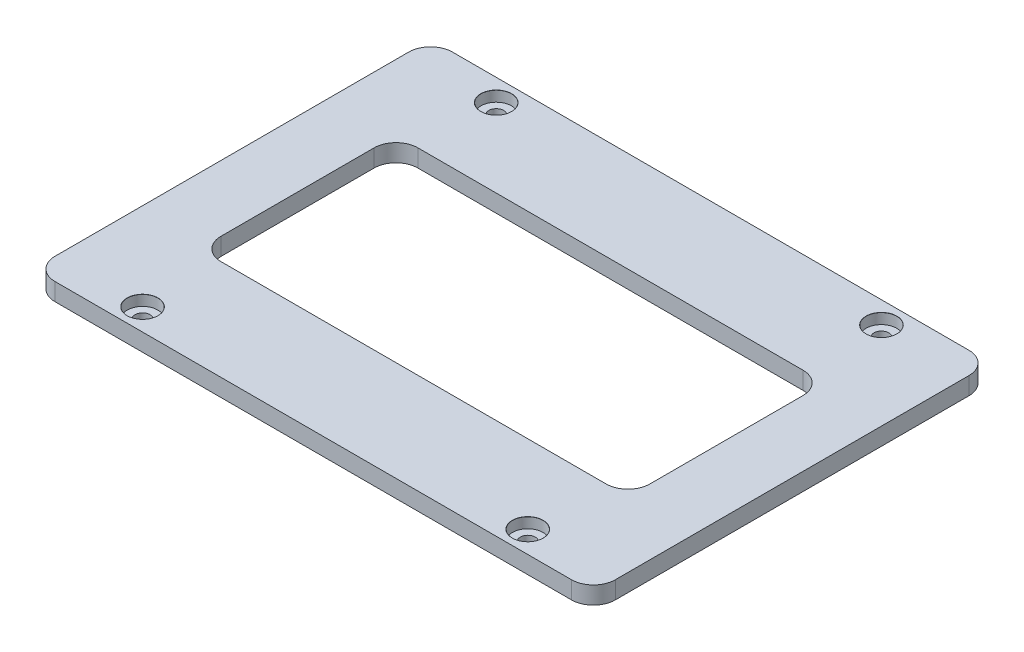
from build123d import *

# Parameters (mm, degrees)
SKETCH1_W                                     = 128
SKETCH1_H                                     = 90.8
BOSS_EXTRUDE1_DEPTH                           = 4
SKETCH2_W                                     = 98
SKETCH2_H                                     = 45
CUT_EXTRUDE1_DEPTH                            = 4
CBORE_FOR_M3_PAN_HEAD_MACHINE_SCREW1_AT_COUNT = 2
CBORE_FOR_M3_PAN_HEAD_MACHINE_SCREW1_AT_PITCH = 88
CBORE_FOR_M3_PAN_HEAD_MACHINE_SCREW1_2_COUNT  = 2
CBORE_FOR_M3_PAN_HEAD_MACHINE_SCREW1_2_PITCH  = 119.468154753
CBORE_FOR_M3_PAN_HEAD_MACHINE_SCREW1_3_COUNT  = 2
CBORE_FOR_M3_PAN_HEAD_MACHINE_SCREW1_3_PITCH  = 80.8
FILLET1_R                                     = 5


with BuildPart() as part:
    # Sketch1 → Boss-Extrude1 (new body)
    with BuildSketch(Plane(origin=(0, 0, 0), x_dir=(1, 0, 0), z_dir=(0, 1, 0))):
        Rectangle(SKETCH1_W, SKETCH1_H)
    extrude(amount=BOSS_EXTRUDE1_DEPTH)

    # Sketch2 → Cut-Extrude1 (cut)
    with BuildSketch(Plane(origin=(0, 4, 0), x_dir=(1, 0, 0), z_dir=(0, 1, 0))):
        Rectangle(SKETCH2_W, SKETCH2_H)
    extrude(amount=-CUT_EXTRUDE1_DEPTH, mode=Mode.SUBTRACT)

    # Sketch5 → CBORE for M3 Pan Head Machine Screw1 (revolve, cut)
    with BuildSketch(Plane(origin=(-44, 4, -40.4), x_dir=(0, 0, 1), z_dir=(1, 0, 0))):
        Polygon((0, 0), (0, 4), (1.7, 4), (1.7, 2.4), (3.5, 2.4), (3.5, 0.025), (3.525, 0), align=None)
    cbore_for_m3_pan_head_machine_screw1 = revolve(axis=Axis((-44, 10.35, -40.4), (0, -1, 0)), mode=Mode.SUBTRACT)

    # CBORE for M3 Pan Head Machine Screw1 at: CBORE for M3 Pan Head Machine Screw1 ×2
    with Locations(*[(i * CBORE_FOR_M3_PAN_HEAD_MACHINE_SCREW1_AT_PITCH, 0, 0) for i in range(1, CBORE_FOR_M3_PAN_HEAD_MACHINE_SCREW1_AT_COUNT)]):
        add(cbore_for_m3_pan_head_machine_screw1, mode=Mode.SUBTRACT)

    # CBORE for M3 Pan Head Machine Screw1 2: CBORE for M3 Pan Head Machine Screw1 ×2
    with Locations(*[Vector(0.7365979677363156, 0, 0.6763308612851625) * (i * CBORE_FOR_M3_PAN_HEAD_MACHINE_SCREW1_2_PITCH) for i in range(1, CBORE_FOR_M3_PAN_HEAD_MACHINE_SCREW1_2_COUNT)]):
        add(cbore_for_m3_pan_head_machine_screw1, mode=Mode.SUBTRACT)

    # CBORE for M3 Pan Head Machine Screw1 3: CBORE for M3 Pan Head Machine Screw1 ×2
    with Locations(*[(0, 0, i * CBORE_FOR_M3_PAN_HEAD_MACHINE_SCREW1_3_PITCH) for i in range(1, CBORE_FOR_M3_PAN_HEAD_MACHINE_SCREW1_3_COUNT)]):
        add(cbore_for_m3_pan_head_machine_screw1, mode=Mode.SUBTRACT)

    # Fillet1
    fillet1_edges = [part.edges().sort_by_distance(p)[0] for p in [
        (49, 2, 22.5),
        (-49, 2, 22.5),
        (49, 2, -22.5),
        (-49, 2, -22.5),
        (64, 2, -45.4),
        (64, 2, 45.4),
        (-64, 2, 45.4),
        (-64, 2, -45.4),
    ]]
    fillet(fillet1_edges, radius=FILLET1_R)


solid = part.part
